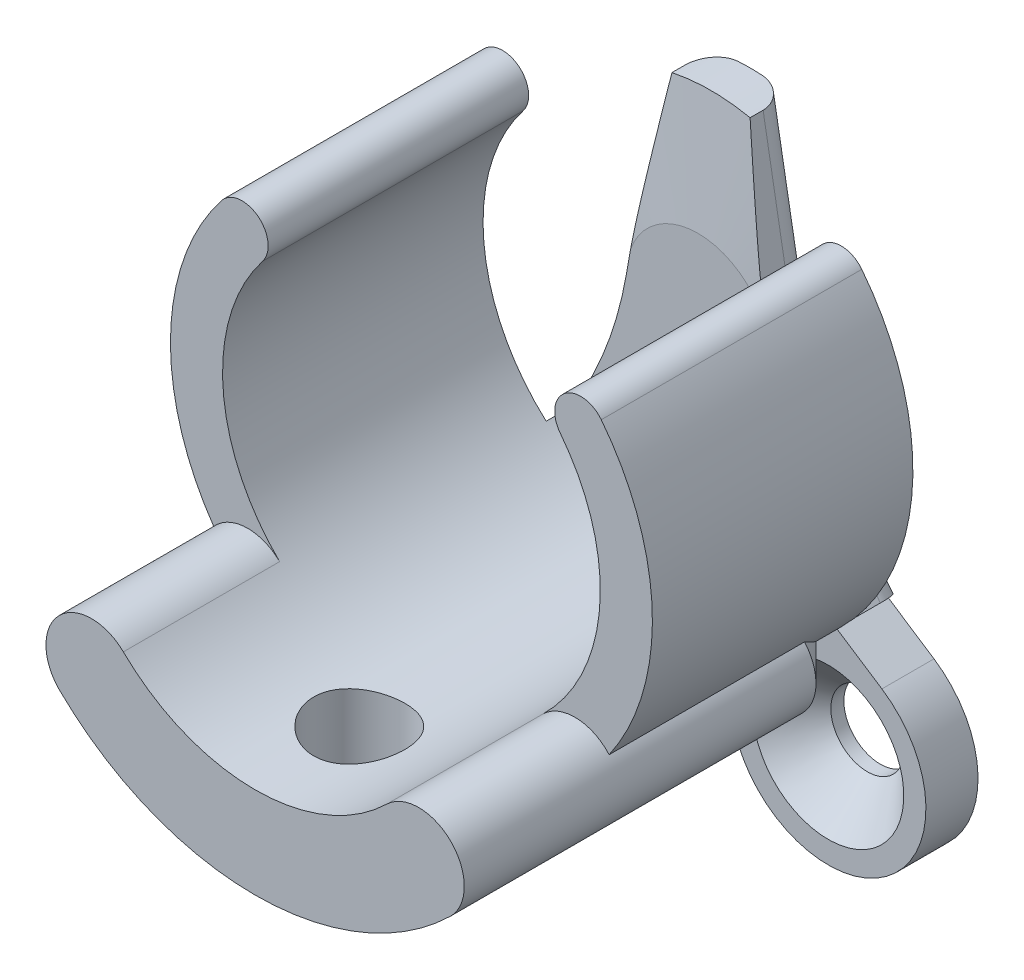
from build123d import *

# Parameters (mm, degrees)
EXTRUDE_577_DEPTH                       = 10
EXTRUDE_START                           = 3
EXTRUDE_1331_DEPTH                      = 2
FILLET_1_R                              = 1
EXTRUDE_2001_DEPTH                      = 6
EXTRUDE_2001_DEPTH_BACK                 = 9
CUT_EXTRUDE_2109_REACH                  = 26.775
CUT_EXTRUDE_2109_END_RADIUS             = 7.25
SKETCH_6_R                              = 1.75
CUT_EXTRUDE_2109_DIRECTION_2_REACH      = 26.775
CUT_EXTRUDE_2109_DIRECTION_2_END_RADIUS = 10.75
SKETCH_7_R                              = 1.4
EXTRUDE_2720_DEPTH                      = 2
EXTRUDE_2720_2_DEPTH                    = 2
CHAMFER_2_SIZE                          = 1.5
EXTRUDE_START_2                         = 1
EXTRUDE_3078_DEPTH                      = 1
CHAMFER_3_SIZE                          = 1.5
CHAMFER_4_SIZE                          = 4.5
CHAMFER_4_SIZE2                         = 0.5


# Some blends are built 0.0001 mm under size
with BuildPart() as part:
    # Эскиз1 → Extrude 577 (new body)
    with BuildSketch(Plane.XY):
        with BuildLine():
            ThreePointArc((-5.712121212, 4.464770012), (0, -7.25), (5.712121212, 4.464770012))
            ThreePointArc((5.712121212, 4.464770012), (5.884169654, 5.868479146), (7.287878788, 5.696430705))
            ThreePointArc((7.287878788, 5.696430705), (0, -9.25), (-7.287878788, 5.696430705))
            ThreePointArc((-7.287878788, 5.696430705), (-5.884169654, 5.868479146), (-5.712121212, 4.464770012))
        make_face()
    extrude(amount=EXTRUDE_577_DEPTH)

    # Эскиз5 → Extrude 2001 (add, two sides: drawn at the far end of the back side and taken through both)
    with BuildSketch(Plane.XY.offset(10).offset(-EXTRUDE_2001_DEPTH_BACK)):
        with BuildLine():
            ThreePointArc((-5.058139535, -5.194008514), (0, -7.25), (5.058139535, -5.194008514))
            ThreePointArc((5.058139535, -5.194008514), (7.532795961, -5.226804475), (7.5, -7.7014609))
            ThreePointArc((7.5, -7.7014609), (0, -10.75), (-7.5, -7.7014609))
            ThreePointArc((-7.5, -7.7014609), (-7.532795961, -5.226804475), (-5.058139535, -5.194008514))
        make_face()
    extrude(amount=EXTRUDE_2001_DEPTH + EXTRUDE_2001_DEPTH_BACK)

    # Cut-Extrude 2109: up to this cylinder (the profile starts outside it)
    cut_extrude_2109_end = Plane(origin=(0, 0, 12), z_dir=(0, 0, -1)) * Cylinder(CUT_EXTRUDE_2109_END_RADIUS, 69.05, mode=Mode.PRIVATE)
    # Эскиз6 → Cut-Extrude 2109 (cut, up to the surface)
    with BuildSketch(Plane(origin=(0, -9.25, 0), x_dir=(-1, 0, 0), z_dir=(0, -1, 0)), mode=Mode.PRIVATE) as cut_extrude_2109_sk1:
        with Locations(Location((0, -12, 0), (0, 0, 270))):
            Circle(SKETCH_6_R)
    cut_extrude_2109_tool1 = extrude(cut_extrude_2109_sk1.sketch, amount=-CUT_EXTRUDE_2109_REACH, mode=Mode.PRIVATE) - cut_extrude_2109_end
    add(cut_extrude_2109_tool1.solids().sort_by_distance((0, -9.25, 12))[0], mode=Mode.SUBTRACT)

    # Cut-Extrude 2109 direction 2: up to this cylinder (the profile starts inside it)
    cut_extrude_2109_direction_2_end = Plane(origin=(0, 0, 12), z_dir=(0, 0, 1)) * Cylinder(CUT_EXTRUDE_2109_DIRECTION_2_END_RADIUS, 76.05, mode=Mode.PRIVATE)
    # Эскиз6 → Cut-Extrude 2109 direction 2 (cut, up to the surface)
    with BuildSketch(Plane(origin=(0, -9.25, 0), x_dir=(-1, 0, 0), z_dir=(0, -1, 0)), mode=Mode.PRIVATE) as cut_extrude_2109_direction_2_sk1:
        with Locations(Location((0, -12, 0), (0, 0, 270))):
            Circle(SKETCH_6_R)
    cut_extrude_2109_direction_2_tool1 = extrude(cut_extrude_2109_direction_2_sk1.sketch, amount=CUT_EXTRUDE_2109_DIRECTION_2_REACH, mode=Mode.PRIVATE) & cut_extrude_2109_direction_2_end
    add(cut_extrude_2109_direction_2_tool1.solids().sort_by_distance((0, -9.25, 12))[0], mode=Mode.SUBTRACT)

    # Фаска2
    chamfer_2_edges = [part.edges().sort_by_distance(p)[0] for p in [
        (-8.027867462, -6.512593205, 1),
        (8.027867462, -6.512593205, 1),
        (0, -10.75, 1),
    ]]
    chamfer(chamfer_2_edges, length=CHAMFER_2_SIZE - 0.0001)  # a hair under: the kernel refuses the full size



with BuildPart() as body_2:
    # Эскиз3 → Extrude 1331 (new body)
    with BuildSketch(Plane(origin=(0, 0, 0), x_dir=(-1, 0, 0), z_dir=(0, 0, -1)).offset(EXTRUDE_START)):
        with BuildLine():
            Line((-1.5, 7.09313048), (-2.75, 0.004028205))
            ThreePointArc((-2.75, 0.004028205), (-3.918577626, -3.728601804), (-6, -7.04006392))
            ThreePointArc((-6, -7.04006392), (0, -9.25), (6, -7.04006392))
            ThreePointArc((6, -7.04006392), (3.918577626, -3.728601804), (2.75, 0.004028205))
            Line((2.75, 0.004028205), (1.5, 7.09313048))
            ThreePointArc((1.5, 7.09313048), (0, 7.25), (-1.5, 7.09313048))
        make_face()
    extrude(amount=-EXTRUDE_1331_DEPTH)

    # Скругление1
    # the kernel refuses this fillet: 1 mm, written as the material it takes off along each edge
    with BuildSketch(Plane(origin=(-17.735965382, 2.646458234, -3), x_dir=(0.6567344577177726, -0.7541219079473445, 0), z_dir=(-0.7541219079473445, -0.6567344577177726, 0))) as fillet_1_piece_1:
        with BuildLine():
            CenterArc((15.217148054 + FILLET_1_R, FILLET_1_R), FILLET_1_R, 180, 90)
            Line((15.217148054 + FILLET_1_R, 0), (15.217148054, 0))
            Line((15.217148054, 0), (15.217148054, FILLET_1_R))
        make_face()
    revolve(axis=Axis((-17.735965382, 2.646458234, -3), (0, 0, 1)), revolution_arc=38.948703068, mode=Mode.SUBTRACT)
    with BuildSketch(Plane(origin=(-2.75, 0.004028205, -3), x_dir=(0, 0, 1), z_dir=(0.17364817766693094, 0.984807753012208, 0)), Plane(origin=(1.065879556, 9.555149862, -3), x_dir=(0, 0, 1), z_dir=(0.1736481776669306, -0.984807753012208, 0))) as fillet_1_piece_2:
        with BuildLine():
            CenterArc((FILLET_1_R, FILLET_1_R), FILLET_1_R, 180, 90)
            Line((0, FILLET_1_R), (0, 0))
            Line((0, 0), (FILLET_1_R, 0))
        make_face()
    extrude(amount=9.698463104, mode=Mode.SUBTRACT)
    with BuildSketch(Plane(origin=(17.735965382, 2.646458234, -3), x_dir=(-0.9848077530122082, -0.17364817766692925, 0), z_dir=(-0.17364817766692925, 0.9848077530122082, 0))) as fillet_1_piece_3:
        with BuildLine():
            CenterArc((15.217148054 + FILLET_1_R, FILLET_1_R), FILLET_1_R, 180, 90)
            Line((15.217148054 + FILLET_1_R, 0), (15.217148054, 0))
            Line((15.217148054, 0), (15.217148054, FILLET_1_R))
        make_face()
    revolve(axis=Axis((17.735965382, 2.646458234, -3), (0, 0, 1)), revolution_arc=38.948703068, mode=Mode.SUBTRACT)


with BuildPart() as body_3:
    # Эскиз7 → Extrude 2720 (new body)
    with BuildSketch(Plane(origin=(0, 0, -3), x_dir=(-1, 0, 0), z_dir=(0, 0, -1))):
        with BuildLine():
            Line((-7.059505235, -8.866162387), (-5.204391621, -7.647013002))
            ThreePointArc((-5.204391621, -7.647013002), (-3.557692308, -8.538461538), (-1.765200931, -9.080009123))
            Line((-1.765200931, -9.080009123), (-1.324605701, -11.255703859))
            ThreePointArc((-1.324605701, -11.255703859), (-6.442307692, -15.461538462), (-7.059505235, -8.866162387))
        make_face()
        with Locations((-5, -12)):
            Circle(SKETCH_7_R, mode=Mode.SUBTRACT)
    extrude(amount=-EXTRUDE_2720_DEPTH)


with BuildPart() as body_4:
    # Эскиз7 → Extrude 2720 2 (new body)
    with BuildSketch(Plane(origin=(0, 0, -3), x_dir=(-1, 0, 0), z_dir=(0, 0, -1))):
        with BuildLine():
            Line((1.324605701, -11.255703859), (1.765200931, -9.080009123))
            ThreePointArc((1.765200931, -9.080009123), (3.557692308, -8.538461538), (5.204391621, -7.647013002))
            Line((5.204391621, -7.647013002), (7.059505235, -8.866162387))
            ThreePointArc((7.059505235, -8.866162387), (6.442307692, -15.461538462), (1.324605701, -11.255703859))
        make_face()
        with Locations(Location((5, -12, 0), (0, 0, 180))):
            Circle(SKETCH_7_R, mode=Mode.SUBTRACT)
    extrude(amount=-EXTRUDE_2720_2_DEPTH)


with BuildPart() as part_1:
    add(part.part)

    add(body_2.part)  # Extrude 3078 merges body 2

    add(body_3.part)  # Extrude 3078 merges body 3

    add(body_4.part)  # Extrude 3078 merges body 4
    # Эскиз8 → Extrude 3078 (add)
    with BuildSketch(Plane(origin=(0, 0, 0), x_dir=(-1, 0, 0), z_dir=(0, 0, -1)).offset(EXTRUDE_START_2)):
        with BuildLine():
            ThreePointArc((-6, -7.04006392), (0, -9.25), (6, -7.04006392))
            ThreePointArc((6, -7.04006392), (5.386302599, -6.244403593), (4.826454597, -5.409975603))
            ThreePointArc((4.826454597, -5.409975603), (0, -7.25), (-4.826454597, -5.409975603))
            ThreePointArc((-4.826454597, -5.409975603), (-5.386302599, -6.244403593), (-6, -7.04006392))
        make_face()
    extrude(amount=-EXTRUDE_3078_DEPTH)

    # Фаска3
    chamfer_3_edges = [part_1.edges().sort_by_distance(p)[0] for p in [
        (6.4, -12, -1),
        (-6.4, -12, -1),
    ]]
    chamfer(chamfer_3_edges, length=CHAMFER_3_SIZE)

    # Фаска4
    chamfer_4_edges = [part_1.edges().sort_by_distance(p)[0] for p in [
        (0, 7.25, -1),
    ]]
    chamfer_4_side = [part_1.faces().sort_by_distance(p)[0] for p in [
        (0, -1.121169898, -1),
    ]]
    chamfer(chamfer_4_edges, length=CHAMFER_4_SIZE, length2=CHAMFER_4_SIZE2, reference=chamfer_4_side[0])


solid = part_1.part
